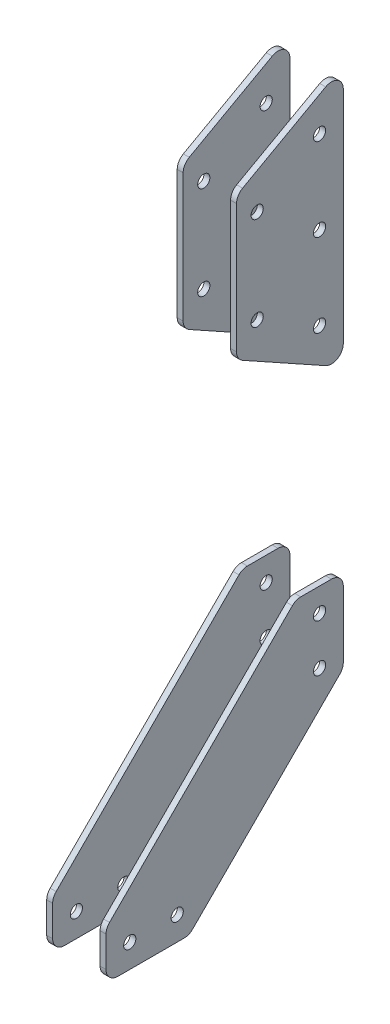
from build123d import *

# Parameters (mm, degrees)
BOSS_EXTRUDE1_DEPTH              = 3.175
BOSS_EXTRUDE1_2_DEPTH            = 3.175
SKETCH3_W                        = 3.2639
SKETCH3_H                        = 3.175
F_1_4_CLEARANCE_HOLE1_AT_2_COUNT = 2
F_1_4_CLEARANCE_HOLE1_AT_2_PITCH = 88.9
F_1_4_CLEARANCE_HOLE1_AT_3_COUNT = 2
F_1_4_CLEARANCE_HOLE1_AT_3_PITCH = 222.25
F_1_4_CLEARANCE_HOLE1_AT_4_COUNT = 2
F_1_4_CLEARANCE_HOLE1_AT_4_PITCH = 247.65
F_1_4_CLEARANCE_HOLE1_AT_5_COUNT = 2
F_1_4_CLEARANCE_HOLE1_AT_5_PITCH = 339.413291578
F_1_4_CLEARANCE_HOLE1_AT_6_COUNT = 2
F_1_4_CLEARANCE_HOLE1_AT_6_PITCH = 332.693947195
F_1_4_CLEARANCE_HOLE1_AT_7_COUNT = 2
F_1_4_CLEARANCE_HOLE1_AT_7_PITCH = 44.45
F_1_4_CLEARANCE_HOLE1_AT_8_COUNT = 2
F_1_4_CLEARANCE_HOLE1_AT_8_PITCH = 38.650517461
F_1_4_CLEARANCE_HOLE1_AT_9_COUNT = 2
F_1_4_CLEARANCE_HOLE1_AT_9_PITCH = 77.064015597
FILLET1_R                        = 6.35
FILLET2_R                        = 6.35


with BuildPart() as part:
    # Sketch1 → Boss-Extrude1 (new body)
    with BuildSketch(Plane(origin=(12.7, 0, 0), x_dir=(0, 0, -1), z_dir=(1, 0, 0))):
        Polygon((-44.45, 317.5), (-44.45, 241.3), (12.7, 209.55), (12.7, 349.25), align=None)
    extrude(amount=BOSS_EXTRUDE1_DEPTH)

    # Sketch3 → 1/4 Clearance Hole1 (revolve, cut)
    with BuildSketch(Plane(origin=(15.875, 323.85, 0), x_dir=(0, 0, -1), z_dir=(0, 1, 0))):
        with Locations((1.63195, 1.5875)):
            Rectangle(SKETCH3_W, SKETCH3_H)
    f_1_4_clearance_hole1 = revolve(axis=Axis((22.225, 323.85, 0), (-1, 0, 0)), mode=Mode.SUBTRACT)

    # 1/4 Clearance Hole1 at 2: 1/4 Clearance Hole1 ×2
    with Locations(*[(0, -i * F_1_4_CLEARANCE_HOLE1_AT_2_PITCH, 0) for i in range(1, F_1_4_CLEARANCE_HOLE1_AT_2_COUNT)]):
        add(f_1_4_clearance_hole1, mode=Mode.SUBTRACT)

    # 1/4 Clearance Hole1 at 7: 1/4 Clearance Hole1 ×2
    with Locations(*[(0, -i * F_1_4_CLEARANCE_HOLE1_AT_7_PITCH, 0) for i in range(1, F_1_4_CLEARANCE_HOLE1_AT_7_COUNT)]):
        add(f_1_4_clearance_hole1, mode=Mode.SUBTRACT)

    # 1/4 Clearance Hole1 at 8: 1/4 Clearance Hole1 ×2
    with Locations(*[Vector(0, -0.5032274152511881, 0.8641540189917584) * (i * F_1_4_CLEARANCE_HOLE1_AT_8_PITCH) for i in range(1, F_1_4_CLEARANCE_HOLE1_AT_8_COUNT)]):
        add(f_1_4_clearance_hole1, mode=Mode.SUBTRACT)

    # 1/4 Clearance Hole1 at 9: 1/4 Clearance Hole1 ×2
    with Locations(*[Vector(0, -0.9011988210269379, 0.43340591248811694) * (i * F_1_4_CLEARANCE_HOLE1_AT_9_PITCH) for i in range(1, F_1_4_CLEARANCE_HOLE1_AT_9_COUNT)]):
        add(f_1_4_clearance_hole1, mode=Mode.SUBTRACT)

    # Fillet1
    fillet1_edges = [part.edges().sort_by_distance(p)[0] for p in [
        (14.2875, 241.3, 44.45),
        (14.2875, 209.55, -12.7),
        (14.2875, 349.25, -12.7),
        (14.2875, 317.5, 44.45),
    ]]
    fillet(fillet1_edges, radius=FILLET1_R)


with BuildPart() as body_2:
    # Sketch1 → Boss-Extrude1 2 (new body)
    with BuildSketch(Plane(origin=(12.7, 0, 0), x_dir=(0, 0, -1), z_dir=(1, 0, 0))):
        Polygon((-12.7, 114.3), (-114.3, 12.7), (-114.3, -12.7), (-69.85, -12.7), (12.7, 69.85), (12.7, 114.3), align=None)
    extrude(amount=BOSS_EXTRUDE1_2_DEPTH)

    # 1/4 Clearance Hole1 at 3: 1/4 Clearance Hole1 ×2
    with Locations(*[(0, -i * F_1_4_CLEARANCE_HOLE1_AT_3_PITCH, 0) for i in range(1, F_1_4_CLEARANCE_HOLE1_AT_3_COUNT)]):
        add(f_1_4_clearance_hole1, mode=Mode.SUBTRACT)

    # 1/4 Clearance Hole1 at 4: 1/4 Clearance Hole1 ×2
    with Locations(*[(0, -i * F_1_4_CLEARANCE_HOLE1_AT_4_PITCH, 0) for i in range(1, F_1_4_CLEARANCE_HOLE1_AT_4_COUNT)]):
        add(f_1_4_clearance_hole1, mode=Mode.SUBTRACT)

    # 1/4 Clearance Hole1 at 5: 1/4 Clearance Hole1 ×2
    with Locations(*[Vector(0, -0.954146487587723, 0.29934007453732503) * (i * F_1_4_CLEARANCE_HOLE1_AT_5_PITCH) for i in range(1, F_1_4_CLEARANCE_HOLE1_AT_5_COUNT)]):
        add(f_1_4_clearance_hole1, mode=Mode.SUBTRACT)

    # 1/4 Clearance Hole1 at 6: 1/4 Clearance Hole1 ×2
    with Locations(*[Vector(0, -0.973417168333576, 0.22903933372554747) * (i * F_1_4_CLEARANCE_HOLE1_AT_6_PITCH) for i in range(1, F_1_4_CLEARANCE_HOLE1_AT_6_COUNT)]):
        add(f_1_4_clearance_hole1, mode=Mode.SUBTRACT)

    # Fillet2
    fillet2_edges = [body_2.edges().sort_by_distance(p)[0] for p in [
        (14.2875, 12.7, 114.3),
        (14.2875, -12.7, 114.3),
        (14.2875, -12.7, 69.85),
        (14.2875, 69.85, -12.7),
        (14.2875, 114.3, -12.7),
        (14.2875, 114.3, 12.7),
    ]]
    fillet(fillet2_edges, radius=FILLET2_R)


with BuildPart() as body_3:
    # Mirror1: mirrored copy
    add(part.part.mirror(Plane(origin=(0, 0, 0), x_dir=(0, 0, 1), z_dir=(1, 0, 0))))


with BuildPart() as body_4:
    # Mirror1 2: mirrored copy
    add(body_2.part.mirror(Plane(origin=(0, 0, 0), x_dir=(0, 0, 1), z_dir=(1, 0, 0))))


solid = Compound([part.part, body_2.part, body_3.part, body_4.part])
